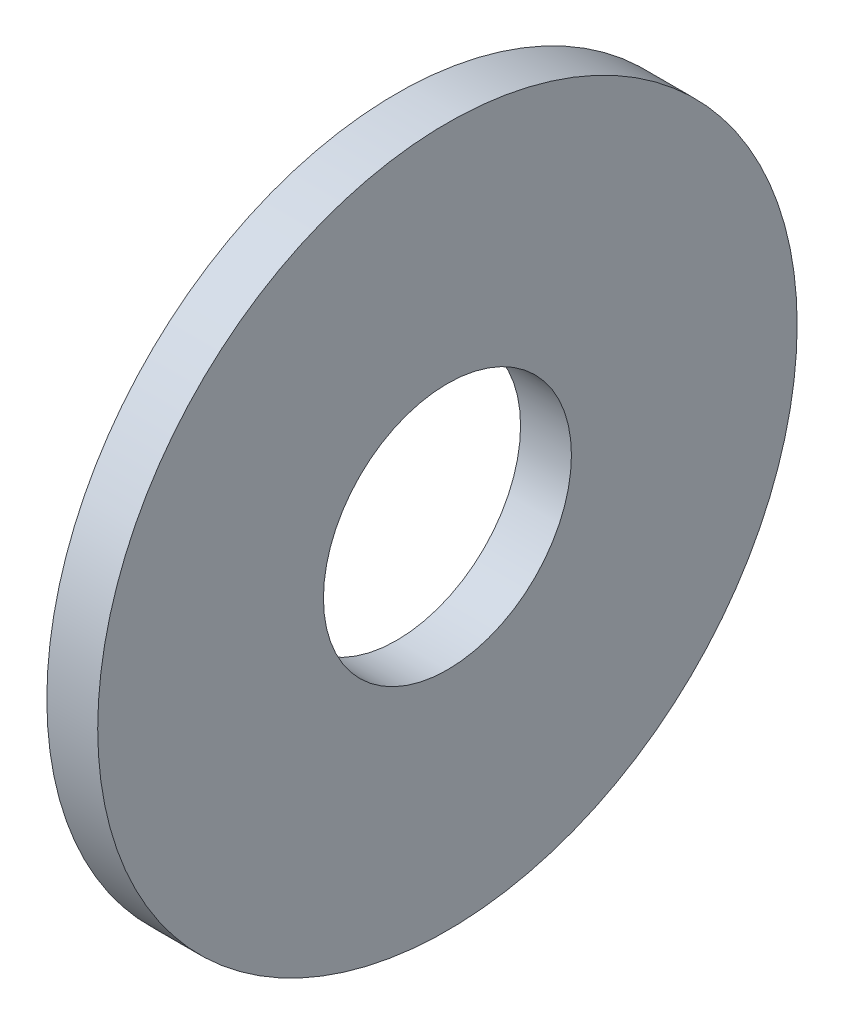
from build123d import *

# Parameters (mm, degrees)
SKETCH1_W = 8
SKETCH1_H = 35.5


with BuildPart() as part:
    # Sketch1 → Base-Revolve (revolve)
    with BuildSketch(Plane.XY):
        with Locations((-4, 37.25)):
            Rectangle(SKETCH1_W, SKETCH1_H)
    revolve(axis=Axis((-34.925, 0, 0), (1, 0, 0)))


solid = part.part
